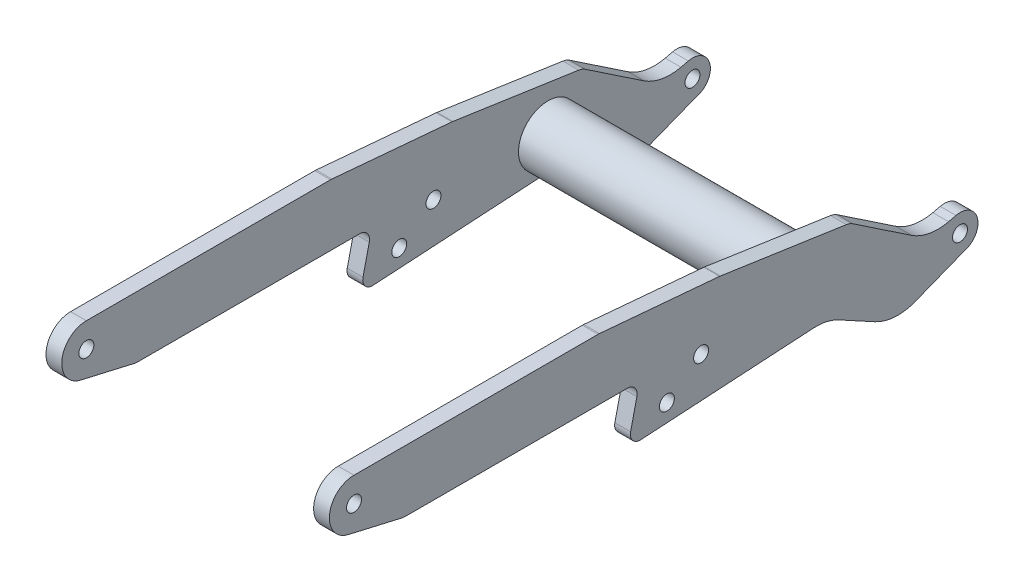
from build123d import *

# Parameters (mm, degrees)
SKETCH1_R                = 0.95
BOSS_EXTRUDE1_DEPTH      = 18
FILLET1_R                = 2
CUT_EXTRUDE1_DEPTH       = 83.46596287
CUT_EXTRUDE1_DEPTH_BACK  = 83.46596287
SKETCH2_W                = 32
SKETCH2_H                = 82.41
BOSS_EXTRUDE2_DEPTH      = 18
BOSS_EXTRUDE2_DEPTH_BACK = 16
SKETCH3_R                = 3.75


with BuildPart() as part:
    # Sketch1 → Boss-Extrude1 (new, symmetric)
    with BuildSketch(Plane(origin=(0, 0, 0), x_dir=(0, 0, -1), z_dir=(1, 0, 0))):
        with BuildLine():
            Line((0, 3.13), (31.1, 3.13))
            Line((31.1, 3.13), (46.5, 1.782674582))
            Line((46.5, 1.782674582), (63, -0.639122384))
            Line((63, -0.639122384), (70.830854785, -5.891324783))
            ThreePointArc((70.830854785, -5.891324783), (73.097482442, -6.811154728), (75.542872081, -6.749855612))
            Line((75.542872081, -6.749855612), (76.479440337, -6.530221264))
            ThreePointArc((76.479440337, -6.530221264), (79.219778736, -8.229440337), (77.520559663, -10.969778736))
            Line((77.520559663, -10.969778736), (71.28999194, -13.416530703))
            ThreePointArc((71.28999194, -13.416530703), (68.724269269, -13.820147489), (66.228359009, -13.10162727))
            Line((66.228359009, -13.10162727), (61.611119998, -10.588406897))
            ThreePointArc((61.611119998, -10.588406897), (60.047418456, -10.001895705), (58.382627665, -9.86911952))
            Line((58.382627665, -9.86911952), (41.966210219, -10.855936181))
            Line((41.966210219, -10.855936181), (36.436012725, -11.188365046))
            ThreePointArc((36.436012725, -11.188365046), (35.406545304, -10.747772649), (35.143046066, -9.659428502))
            Line((35.143046066, -9.659428502), (35.942400407, -6.197044459))
            ThreePointArc((35.942400407, -6.197044459), (35.702698022, -5.137712345), (34.724437826, -4.665855641))
            Line((34.724437826, -4.665855641), (6.2959032, -4.665855641))
            Line((6.2959032, -4.665855641), (-0.7040968, -3.049778303))
            ThreePointArc((-0.7040968, -3.049778303), (-3.109879908, 0.354326059), (0, 3.13))
        make_face()
        Circle(SKETCH1_R, mode=Mode.SUBTRACT)
        with Locations((77, -8.75)):
            Circle(SKETCH1_R, mode=Mode.SUBTRACT)
        with Locations((44.1, -5.6)):
            Circle(SKETCH1_R, mode=Mode.SUBTRACT)
        with Locations((39.75, -8.75)):
            Circle(SKETCH1_R, mode=Mode.SUBTRACT)
    extrude(amount=BOSS_EXTRUDE1_DEPTH, both=True)

    # Fillet1
    # the kernel refuses this fillet: 2 mm, written as the material it takes off along each edge
    with BuildSketch(Plane(origin=(18.218304715, 3.13, -31.1), x_dir=(0, -0.08715574274766148, -0.9961946980917452), z_dir=(-1, 0, 0))) as fillet1_piece_1:
        with BuildLine():
            CenterArc((FILLET1_R * 0.0436609429085, FILLET1_R), FILLET1_R, 265, 5)
            Line((-FILLET1_R * 0.0434947998391, FILLET1_R * 0.00380530190825), (0, 0))
            Line((0, 0), (FILLET1_R * 0.0436609429085, 0))
        make_face()
    extrude(amount=36.436609429, mode=Mode.SUBTRACT)
    with BuildSketch(Plane(origin=(18.14621298, 1.782674582, -46.5), x_dir=(0, -0.14521967007723557, -0.9893994377513355), z_dir=(-1, 0, 0))) as fillet1_piece_2:
        with BuildLine():
            CenterArc((FILLET1_R * 0.0292425960983, FILLET1_R), FILLET1_R, 266.65, 3.35)
            Line((-FILLET1_R * 0.02919262642, FILLET1_R * 0.00170879761001), (0, 0))
            Line((0, 0), (FILLET1_R * 0.0292425960983, 0))
        make_face()
    extrude(amount=36.292425961, mode=Mode.SUBTRACT)
    with BuildSketch(Plane(origin=(19.131384491, -0.639122384, -63), x_dir=(0, -0.5570205743376995, -0.8304986934152874), z_dir=(-1, 0, 0))) as fillet1_piece_3:
        with BuildLine():
            CenterArc((FILLET1_R * 0.226276898255, FILLET1_R), FILLET1_R, 244.5, 25.5)
            Line((-FILLET1_R * 0.204234198553, FILLET1_R * 0.0974147156501), (0, 0))
            Line((0, 0), (FILLET1_R * 0.226276898255, 0))
        make_face()
    extrude(amount=38.262768983, mode=Mode.SUBTRACT)
    with BuildSketch(Plane(origin=(18.569678042, -4.665855641, -6.2959032), x_dir=(0, 0.22495105434386356, 0.9743700647852356), z_dir=(-1, 0, 0))) as fillet1_piece_4:
        with BuildLine():
            CenterArc((FILLET1_R * 0.113935608302, FILLET1_R), FILLET1_R, 257, 13)
            Line((-FILLET1_R * 0.111015446042, FILLET1_R * 0.0256299352148), (0, 0))
            Line((0, 0), (FILLET1_R * 0.113935608302, 0))
        make_face()
    extrude(amount=37.139356083, mode=Mode.SUBTRACT)

    # Sketch2 → Cut-Extrude1 (cut, two sides: drawn at the far end of the back side and taken through both)
    with BuildSketch(Plane(origin=(0, 0, 0), x_dir=(1, 0, 0), z_dir=(0, 1, 0)).offset(-CUT_EXTRUDE1_DEPTH_BACK)):
        with Locations((0, 38.075)):
            Rectangle(SKETCH2_W, SKETCH2_H)
    extrude(amount=CUT_EXTRUDE1_DEPTH + CUT_EXTRUDE1_DEPTH_BACK, mode=Mode.SUBTRACT)


with BuildPart() as cut_extrude1_piece_1:
    # of the separate pieces the step leaves, piece 1, a body of its own (cut_extrude1_pieces)
    add(part.part.solids().sort_by_distance((16, -13.416530703, -71.28999194))[0])



with BuildPart() as cut_extrude1_piece_2:
    # of the separate pieces the step leaves, piece 2, a body of its own (cut_extrude1_pieces)
    add(part.part.solids().sort_by_distance((-18, -13.416530703, -71.28999194))[0])


with BuildPart() as cut_extrude1_piece_1_1:
    add(cut_extrude1_piece_1.part)

    add(cut_extrude1_piece_2.part)  # Boss-Extrude2 merges Cut-Extrude1 piece 2
    # Sketch3 → Boss-Extrude2 (add, two sides: drawn at the far end of the back side and taken through both)
    with BuildSketch(Plane(origin=(0, 0, 0), x_dir=(0, 0, -1), z_dir=(1, 0, 0)).offset(-BOSS_EXTRUDE2_DEPTH_BACK)):
        with Locations((58.65, -5.75)):
            Circle(SKETCH3_R)
    extrude(amount=BOSS_EXTRUDE2_DEPTH + BOSS_EXTRUDE2_DEPTH_BACK)


solid = cut_extrude1_piece_1_1.part
